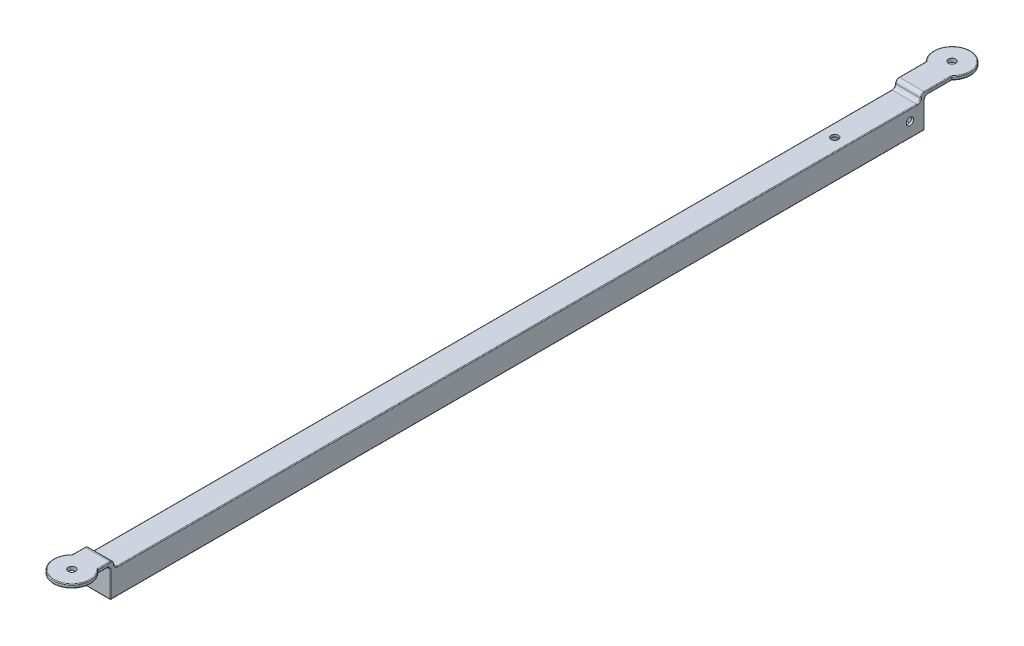
from build123d import *

# Parameters (mm, degrees)
SKETCH_1_W          = 35
SKETCH_1_H          = 35
SKETCH_1_W_2        = 29
SKETCH_1_H_2        = 29
EXTRUDE_1_DEPTH     = 1100
SKETCH_2_W          = 35
SKETCH_2_H          = 45
EXTRUDE_1_2_DEPTH   = 5
EXTRUDE_2_DEPTH     = 5
SKETCH_5_R          = 5
CUT_EXTRUDE_1_DEPTH = 1166.793721033
SKETCH_7_W          = 35
SKETCH_7_H          = 45
EXTRUDE_3_DEPTH     = 5
EXTRUDE_4_DEPTH     = 5
FILLET_1_R          = 5
FILLET_2_R          = 1
SKETCH_9_R          = 5
CUT_EXTRUDE_2_DEPTH = 1167.09926689


with BuildPart() as part:
    # 草图1 → Extrude 1 (new body)
    with BuildSketch(Plane.XY):
        Rectangle(SKETCH_1_W, SKETCH_1_H)
        Rectangle(SKETCH_1_W_2, SKETCH_1_H_2, mode=Mode.SUBTRACT)
    extrude(amount=EXTRUDE_1_DEPTH)

    # 草图2 → Extrude 1 2 (add)
    with BuildSketch(Plane.XY.offset(1100)):
        with Locations((0, 5)):
            Rectangle(SKETCH_2_W, SKETCH_2_H)
    extrude(amount=EXTRUDE_1_2_DEPTH)

    # 草图6 → 凸台-拉伸2 (add)
    with BuildSketch(Plane(origin=(0, 27.5, 0), x_dir=(1, 0, 0), z_dir=(0, 1, 0))):
        with BuildLine():
            Line((17.5, -1105), (-17.5, -1105))
            Line((-17.5, -1105), (-17.5, -1122.146428929))
            ThreePointArc((-17.5, -1122.146428929), (0, -1115), (17.5, -1122.146428929))
            Line((17.5, -1122.146428929), (17.5, -1105))
        make_face()
        with BuildLine():
            ThreePointArc((17.5, -1122.146428929), (0, -1115), (-17.5, -1122.146428929))
            Line((-17.5, -1122.146428929), (-17.5, -1140))
            Line((-17.5, -1140), (-5, -1140))
            ThreePointArc((-5, -1140), (0, -1135), (5, -1140))
            Line((5, -1140), (17.5, -1140))
            Line((17.5, -1140), (17.5, -1122.146428929))
        make_face()
        with BuildLine():
            Line((-17.5, -1140), (-17.5, -1122.146428929))
            ThreePointArc((-17.5, -1122.146428929), (-9.682458366, -1163.048861143), (25, -1140))
            ThreePointArc((25, -1140), (23.048861143, -1130.317541634), (17.5, -1122.146428929))
            Line((17.5, -1122.146428929), (17.5, -1140))
            Line((17.5, -1140), (5, -1140))
            ThreePointArc((5, -1140), (0, -1145), (-5, -1140))
            Line((-5, -1140), (-17.5, -1140))
        make_face()
    extrude(amount=-EXTRUDE_2_DEPTH)

    # 草图5 → 切除-拉伸1 (cut, through all)
    with BuildSketch(Plane(origin=(0, 17.5, 0), x_dir=(1, 0, 0), z_dir=(0, 1, 0))):
        with Locations(Location((0, -100, 0), (0, 0, 270))):
            Circle(SKETCH_5_R)
    extrude(amount=-CUT_EXTRUDE_1_DEPTH, mode=Mode.SUBTRACT)

    # 草图7 → 凸台-拉伸3 (add)
    with BuildSketch(Plane(origin=(0, 0, 0), x_dir=(-1, 0, 0), z_dir=(0, 0, -1))):
        with Locations((0, 5)):
            Rectangle(SKETCH_7_W, SKETCH_7_H)
    extrude(amount=EXTRUDE_3_DEPTH)

    # 草图8 → 凸台-拉伸4 (add)
    with BuildSketch(Plane(origin=(0, 27.5, 0), x_dir=(1, 0, 0), z_dir=(0, 1, 0))):
        with BuildLine():
            Line((-17.5, 5), (17.5, 5))
            Line((17.5, 5), (17.5, 42.146428929))
            ThreePointArc((17.5, 42.146428929), (0, 35), (-17.5, 42.146428929))
            Line((-17.5, 42.146428929), (-17.5, 5))
        make_face()
        with BuildLine():
            ThreePointArc((-17.5, 42.146428929), (0, 35), (17.5, 42.146428929))
            Line((17.5, 42.146428929), (17.5, 60))
            Line((17.5, 60), (5, 60))
            ThreePointArc((5, 60), (0, 55), (-5, 60))
            Line((-5, 60), (-17.5, 60))
            Line((-17.5, 60), (-17.5, 42.146428929))
        make_face()
        with BuildLine():
            Line((17.5, 60), (17.5, 42.146428929))
            ThreePointArc((17.5, 42.146428929), (23.048861143, 50.317541634), (25, 60))
            ThreePointArc((25, 60), (-9.682458366, 83.048861143), (-17.5, 42.146428929))
            Line((-17.5, 42.146428929), (-17.5, 60))
            Line((-17.5, 60), (-5, 60))
            ThreePointArc((-5, 60), (0, 65), (5, 60))
            Line((5, 60), (17.5, 60))
        make_face()
    extrude(amount=-EXTRUDE_4_DEPTH)

    # 圆角1
    fillet_1_edges = [part.edges().sort_by_distance(p)[0] for p in [
        (0, 17.5, 0),
        (0, 22.5, -5),
        (0, 27.5, 0),
        (0, 17.5, 1100),
        (0, 22.5, 1105),
        (0, 27.5, 1100),
    ]]
    fillet(fillet_1_edges, radius=FILLET_1_R - 0.0001)  # a hair under: the kernel refuses the full size

    # 圆角2
    fillet_2_edges = [part.edges().sort_by_distance(p)[0] for p in [
        (-17.5, 17.5, 550),
        (17.5, 17.5, 550),
        (17.5, 22.5, -26.073164464),
        (-17.5, 22.5, -26.073164464),
        (17.5, 5e-05, -5),
        (17.5, 22.5, 1116.073164464),
        (17.5, 26.035563195, 1101.464436805),
        (17.5, 26.035563195, -1.464436805),
        (-17.5, 5e-05, 1105),
        (-17.5, 22.5, 1116.073164464),
        (-17.5, 26.035563195, 1101.464436805),
        (-17.5, 26.035563195, -1.464436805),
        (-17.5, 18.964436805, 1.464436805),
        (17.5, 18.964436805, 1.464436805),
        (-17.5, 21.035563195, -6.464436805),
        (17.5, 21.035563195, -6.464436805),
        (-17.5, 18.964436805, 1098.535563195),
        (17.5, 18.964436805, 1098.535563195),
        (17.5, 21.035563195, 1106.464436805),
        (-17.5, 21.035563195, 1106.464436805),
        (17.5, 27.5, 1113.573164464),
        (-17.5, 27.5, 1113.573164464),
        (17.5, 5e-05, 1105),
        (0, -17.5, 1105),
        (-17.5, 25, 1122.146428929),
        (-9.682458366, 22.5, 1163.048861143),
        (17.5, 25, 1122.146428929),
        (-9.682458366, 27.5, 1163.048861143),
        (17.5, -17.5, 550),
        (0, -17.5, 95),
        (-17.5, -17.5, 550),
        (17.5, 27.5, -23.573164464),
        (-17.5, 27.5, -23.573164464),
        (0, -17.5, -5),
        (-17.5, 5e-05, -5),
        (17.5, 25, -42.146428929),
        (0, 22.5, -85),
        (-17.5, 25, -42.146428929),
        (0, 27.5, -85),
    ]]
    fillet(fillet_2_edges, radius=FILLET_2_R)

    # 草图9 → 切除-拉伸2 (cut, through all)
    with BuildSketch(Plane(origin=(17.5, 0, 0), x_dir=(0, 0, -1), z_dir=(1, 0, 0))):
        with Locations((-15, 2.5)):
            Circle(SKETCH_9_R)
    extrude(amount=-CUT_EXTRUDE_2_DEPTH, mode=Mode.SUBTRACT)


solid = part.part
